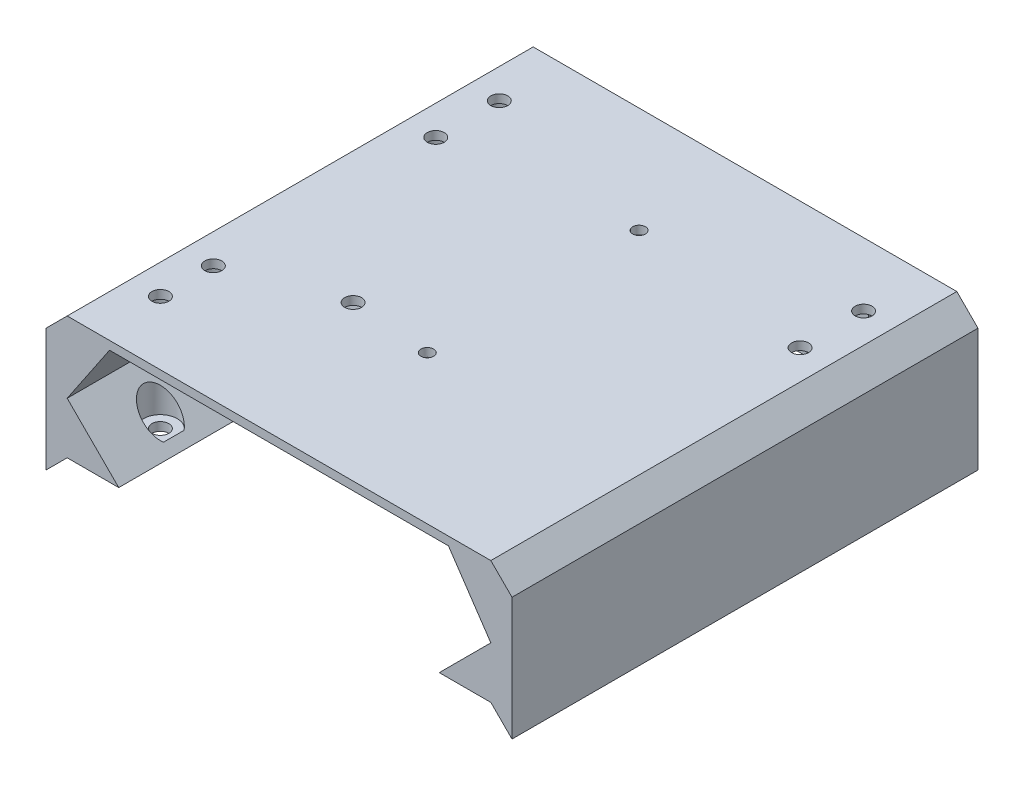
from build123d import *
from build123d.topology import SkipClean

# Parameters (mm, degrees)
SKETCH1_W           = 110
SKETCH1_H           = 110
BOSS_EXTRUDE1_DEPTH = 2
SKETCH2_R           = 2
CUT_EXTRUDE1_DEPTH  = 78.807454656
SKETCH3_W           = 5
SKETCH3_H           = 110
BOSS_EXTRUDE2_DEPTH = 32
SKETCH4_R           = 1.5
CUT_EXTRUDE2_DEPTH  = 85.888161719
SKETCH5_R           = 2
CUT_EXTRUDE3_DEPTH  = 85.107074613
CHAMFER1_SIZE       = 14.825609685
CHAMFER1_SIZE_2     = 10
SKETCH6_R           = 4
CUT_EXTRUDE4_DEPTH  = 85.107074613
CHAMFER2_SIZE       = 5
BOSS_EXTRUDE3_DEPTH = 2
CUT_EXTRUDE5_DEPTH  = 2
CHAMFER3_SIZE       = 5
CUT_EXTRUDE6_DEPTH  = 2
BOSS_EXTRUDE4_DEPTH = 108
SKETCH12_R          = 2
CUT_EXTRUDE7_DEPTH  = 85.107074613
SKETCH13_R          = 4
CUT_EXTRUDE8_DEPTH  = 25


# Some blends are built 0.0001 mm under size
with BuildPart() as part:
    # Sketch1 → Boss-Extrude1 (new body)
    with BuildSketch(Plane(origin=(0, 0, 0), x_dir=(1, 0, 0), z_dir=(0, 1, 0))):
        Rectangle(SKETCH1_W, SKETCH1_H)
    extrude(amount=BOSS_EXTRUDE1_DEPTH)

    # Sketch2 → Cut-Extrude1 (cut, through all)
    with BuildSketch(Plane(origin=(0, 2, 0), x_dir=(1, 0, 0), z_dir=(0, 1, 0))):
        with Locations(Location((-43, -40, 0), (0, 0, 270))):
            Circle(SKETCH2_R)
        with Locations(Location((-43, -27.5, 0), (0, 0, 270))):
            Circle(SKETCH2_R)
        with Locations(Location((-19, -18.5, 0), (0, 0, 270))):
            Circle(SKETCH2_R)
    extrude(amount=-CUT_EXTRUDE1_DEPTH, mode=Mode.SUBTRACT)

    # Sketch3 → Boss-Extrude2 (add)
    with BuildSketch(Plane.XZ):
        with Locations((-52.5, 0)):
            Rectangle(SKETCH3_W, SKETCH3_H)
        with Locations((52.5, 0)):
            Rectangle(SKETCH3_W, SKETCH3_H)
    extrude(amount=BOSS_EXTRUDE2_DEPTH)

    # Sketch4 → Cut-Extrude2 (cut, through all)
    with BuildSketch(Plane(origin=(0, 2, 0), x_dir=(1, 0, 0), z_dir=(0, 1, 0))):
        with Locations(Location((0, 30, 0), (0, 0, 270))):
            Circle(SKETCH4_R)
        with Locations(Location((0, -20, 0), (0, 0, 270))):
            Circle(SKETCH4_R)
    extrude(amount=-CUT_EXTRUDE2_DEPTH, mode=Mode.SUBTRACT)

    # Sketch5 → Cut-Extrude3 (cut, through all)
    with BuildSketch(Plane.XZ):
        with Locations(Location((-43, -25, 0), (0, 0, 270))):
            Circle(SKETCH5_R)
        with Locations(Location((-43, -40, 0), (0, 0, 270))):
            Circle(SKETCH5_R)
        with Locations(Location((43, -25, 0), (0, 0, 270))):
            Circle(SKETCH5_R)
        with Locations(Location((43, -40, 0), (0, 0, 270))):
            Circle(SKETCH5_R)
    extrude(amount=-CUT_EXTRUDE3_DEPTH, mode=Mode.SUBTRACT)

    # Chamfer1
    # the kernel refuses this chamfer: 14.825609685, 10 mm, written as the material it adds along each edge
    with BuildSketch(Plane(origin=(-50, 0, 55), x_dir=(-0.021644705014774085, -0.9997657259302418, 0), z_dir=(0, 0, -1))) as chamfer1_piece_1_section:
        Polygon((CHAMFER1_SIZE * 0.999765725939, -CHAMFER1_SIZE * 0.021644705015), (-CHAMFER1_SIZE_2 * 0.0216447050148, -CHAMFER1_SIZE_2 * 0.99976572593), (0, 0), align=None)
    chamfer1_piece_1 = extrude(amount=110, mode=Mode.PRIVATE)
    chamfer1_piece_1 = chamfer1_piece_1 - Plane(origin=(-43, -5.019728398, 40), x_dir=(0, 0, 1), z_dir=(0, 1, 0)) * Cylinder(2, 280, mode=Mode.PRIVATE)
    chamfer1_piece_1 = chamfer1_piece_1 - Plane(origin=(-43, -5.019728398, 27.5), x_dir=(0, 0, 1), z_dir=(0, 1, 0)) * Cylinder(2, 280, mode=Mode.PRIVATE)
    chamfer1_piece_1 = chamfer1_piece_1 - Plane(origin=(-43, -5.019728398, -25), x_dir=(0, 0, -1), z_dir=(0, -1, 0)) * Cylinder(2, 280, mode=Mode.PRIVATE)
    chamfer1_piece_1 = chamfer1_piece_1 - Plane(origin=(-43, -5.019728398, -40), x_dir=(0, 0, -1), z_dir=(0, -1, 0)) * Cylinder(2, 280, mode=Mode.PRIVATE)
    add(chamfer1_piece_1)
    with BuildSketch(Plane(origin=(50, 0, 55), x_dir=(-0.9988697089125116, 0.04753214298802855, 0), z_dir=(0, 0, -1))) as chamfer1_piece_2_section:
        Polygon((CHAMFER1_SIZE_2 * 0.998869708913, -CHAMFER1_SIZE_2 * 0.047532142988), (-CHAMFER1_SIZE * 0.0475321429884, -CHAMFER1_SIZE * 0.998869708921), (0, 0), align=None)
    chamfer1_piece_2 = extrude(amount=110, mode=Mode.PRIVATE)
    chamfer1_piece_2 = chamfer1_piece_2 - Plane(origin=(43, -4.982049295, -25), x_dir=(0, 0, -1), z_dir=(0, -1, 0)) * Cylinder(2, 280, mode=Mode.PRIVATE)
    chamfer1_piece_2 = chamfer1_piece_2 - Plane(origin=(43, -4.982049295, -40), x_dir=(0, 0, -1), z_dir=(0, -1, 0)) * Cylinder(2, 280, mode=Mode.PRIVATE)
    add(chamfer1_piece_2)

    # Sketch6 → Cut-Extrude4 (cut, through all)
    with BuildSketch(Plane.XZ):
        with Locations((-43, 40)):
            Circle(SKETCH6_R)
        with Locations((-43, 27.5)):
            Circle(SKETCH6_R)
        with Locations((-43, -25)):
            Circle(SKETCH6_R)
        with Locations((-43, -40)):
            Circle(SKETCH6_R)
        with Locations((43, -25)):
            Circle(SKETCH6_R)
        with Locations((43, -40)):
            Circle(SKETCH6_R)
    extrude(amount=CUT_EXTRUDE4_DEPTH, mode=Mode.SUBTRACT)

    # Chamfer2
    chamfer2_edges = [part.edges().sort_by_distance(p)[0] for p in [
        (55, 2, 0),
        (-55, 2, 0),
    ]]
    chamfer(chamfer2_edges, length=CHAMFER2_SIZE)

    # Sketch8 → Boss-Extrude3 (add)
    with BuildSketch(Plane(origin=(0, 0, -55), x_dir=(-1, 0, 0), z_dir=(0, 0, -1))):
        Polygon((-55, -32), (55, -32), (55, -3), (50, 2), (-50, 2), (-55, -3), align=None)
    extrude(amount=-BOSS_EXTRUDE3_DEPTH)

    # Sketch9 → Cut-Extrude5 (cut)
    with BuildSketch(Plane(origin=(0, 0, -55), x_dir=(-1, 0, 0), z_dir=(0, 0, -1))):
        with BuildLine():
            Line((-31.125, -8), (-31.125, -20))
            ThreePointArc((-31.125, -20), (-33.375, -22.25), (-35.625, -20))
            Line((-35.625, -20), (-35.625, -8))
            ThreePointArc((-35.625, -8), (-33.375, -5.75), (-31.125, -8))
        make_face()
    cut_extrude5 = extrude(amount=-CUT_EXTRUDE5_DEPTH, mode=Mode.SUBTRACT)

    # Mirror1: Cut-Extrude5 across plane
    add(cut_extrude5.mirror(Plane(origin=(0, 0, 0), x_dir=(0, 0, 1), z_dir=(1, 0, 0))), mode=Mode.SUBTRACT)

    # Chamfer3
    chamfer3_edges = [part.edges().sort_by_distance(p)[0] for p in [
        (50, -32, 1),
        (-50, -32, 1),
    ]]
    chamfer(chamfer3_edges, length=CHAMFER3_SIZE - 0.0001)  # a hair under: the kernel refuses the full size

    # Sketch10 → Cut-Extrude6 (cut)
    with SkipClean():  # the faces are left unmerged after this step: merging them gives an invalid solid
        with BuildSketch(Plane.XY.offset(-53)):
            Polygon((-50, -27), (50, -27), (55, -32), (-55, -32), align=None)
        extrude(amount=-CUT_EXTRUDE6_DEPTH, mode=Mode.SUBTRACT)

    # Sketch11 → Boss-Extrude4 (add)
    with SkipClean():  # the faces are left unmerged after this step: merging them gives an invalid solid
        with BuildSketch(Plane.XY.offset(55)):
            Polygon((-50, -14.825609685), (-37.825609685, -27), (-50, -27), align=None)
        boss_extrude4 = extrude(amount=-BOSS_EXTRUDE4_DEPTH)

    # Sketch12 → Cut-Extrude7 (cut, through all)
    with SkipClean():  # the faces are left unmerged after this step: merging them gives an invalid solid
        with BuildSketch(Plane(origin=(0, 0, 0), x_dir=(1, 0, 0), z_dir=(0, 1, 0))):
            with Locations(Location((-43, -40, 0), (0, 0, 270))):
                Circle(SKETCH12_R)
            with Locations(Location((-43, -27.5, 0), (0, 0, 270))):
                Circle(SKETCH12_R)
            with Locations(Location((-43, 25, 0), (0, 0, 90))):
                Circle(SKETCH12_R)
            with Locations(Location((-43, 40, 0), (0, 0, 90))):
                Circle(SKETCH12_R)
        cut_extrude7 = extrude(amount=-CUT_EXTRUDE7_DEPTH, mode=Mode.SUBTRACT)

    # Sketch13 → Cut-Extrude8 (cut)
    with SkipClean():  # the faces are left unmerged after this step: merging them gives an invalid solid
        with BuildSketch(Plane.XZ):
            with Locations((-43, 40)):
                Circle(SKETCH13_R)
            with Locations((-43, 27.5)):
                Circle(SKETCH13_R)
            with Locations((-43, -25)):
                Circle(SKETCH13_R)
            with Locations((-43, -40)):
                Circle(SKETCH13_R)
        cut_extrude8 = extrude(amount=CUT_EXTRUDE8_DEPTH, mode=Mode.SUBTRACT)

    # Mirror2: Boss-Extrude4, Cut-Extrude7, Cut-Extrude8 across plane
    with SkipClean():  # the faces are left unmerged after this step: merging them gives an invalid solid
        add(boss_extrude4.mirror(Plane(origin=(0, 0, 0), x_dir=(0, 0, 1), z_dir=(1, 0, 0))))
        add(cut_extrude7.mirror(Plane(origin=(0, 0, 0), x_dir=(0, 0, 1), z_dir=(1, 0, 0))), mode=Mode.SUBTRACT)
        add(cut_extrude8.mirror(Plane(origin=(0, 0, 0), x_dir=(0, 0, 1), z_dir=(1, 0, 0))), mode=Mode.SUBTRACT)


solid = part.part
